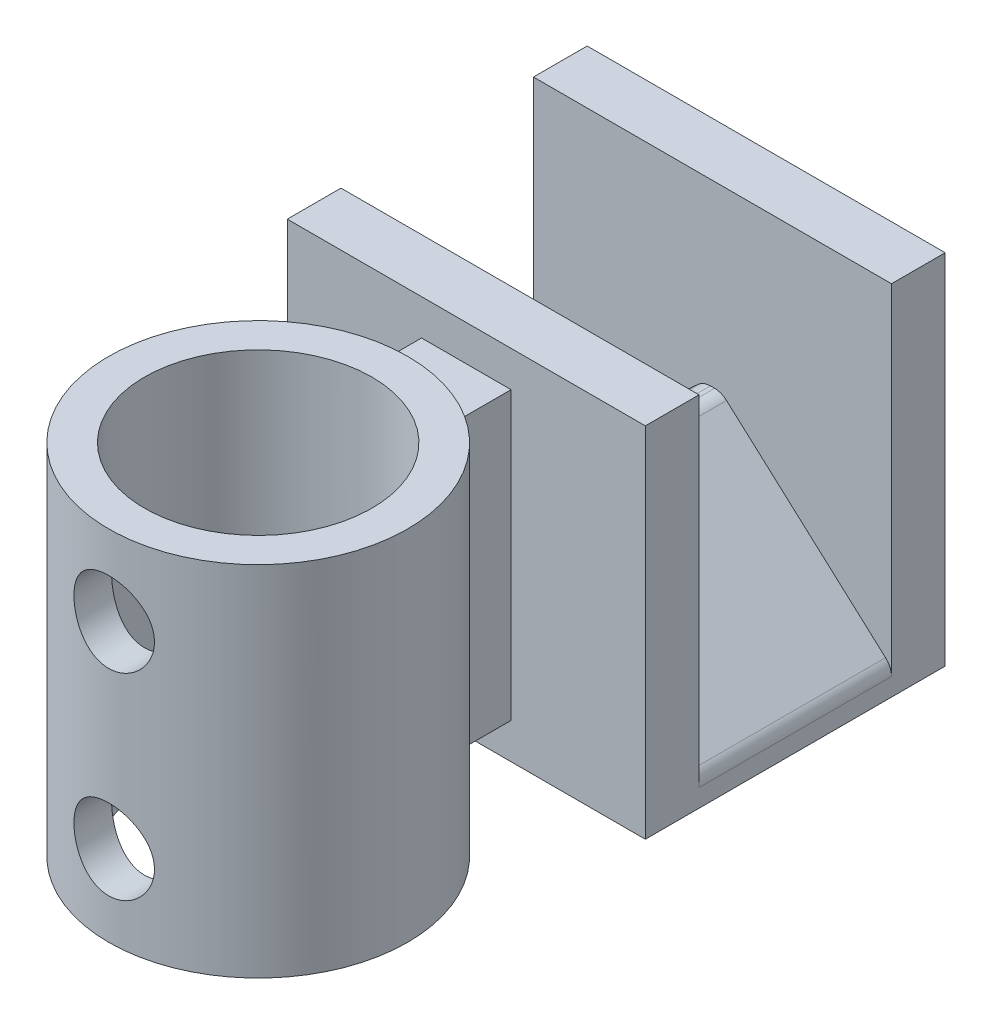
from build123d import *

# Parameters (mm, degrees)
SKETCH2_W                       = 20
SKETCH2_H                       = 10
BOSS_EXTRUDE1_DEPTH             = 5.375
CHAMFER1_SIZE                   = 9.5
CHAMFER1_SIZE2                  = 8.553838421
FILLET3_R                       = 1
SKETCH3_W                       = 20
SKETCH3_H                       = 20
BOSS_EXTRUDE2_DEPTH             = 3
BOSS_EXTRUDE3_REACH             = 21.878
SKETCH6_R                       = 8.35
SKETCH6_R_2                     = 6.35
BOSS_EXTRUDE3_DIRECTION_2_REACH = 21.878
BOSS_EXTRUDE4_REACH             = 28.907
BOSS_EXTRUDE4_END_RADIUS        = 8.35
SKETCH5_W                       = 5
SKETCH5_H                       = 16
CUT_EXTRUDE1_REACH              = 35.618
CUT_EXTRUDE1_END_RADIUS         = 8.35
SKETCH7_R                       = 2.25


with BuildPart() as part:
    # Sketch2 → Boss-Extrude1 (new, symmetric)
    with BuildSketch(Plane.XY):
        Rectangle(SKETCH2_W, SKETCH2_H)
    extrude(amount=BOSS_EXTRUDE1_DEPTH, both=True)

    # Chamfer1
    chamfer1_edges = [part.edges().sort_by_distance(p)[0] for p in [
        (10, 5, 0),
        (-10, 5, 0),
    ]]
    chamfer1_side = [part.faces().sort_by_distance(p)[0] for p in [
        (0, 5, 0),
    ]]
    chamfer(chamfer1_edges, length=CHAMFER1_SIZE, length2=CHAMFER1_SIZE2, reference=chamfer1_side[0])

    # Fillet3
    fillet3_edges = [part.edges().sort_by_distance(p)[0] for p in [
        (-10, -3.553838421, 0),
        (10, -3.553838421, 0),
        (0.5, 5, 0),
        (-0.5, 5, 0),
    ]]
    fillet(fillet3_edges, radius=FILLET3_R)

    # Sketch3 → Boss-Extrude2 (add)
    with BuildSketch(Plane.XY.offset(5.375)):
        with Locations((0, 5)):
            Rectangle(SKETCH3_W, SKETCH3_H)
    boss_extrude2 = extrude(amount=BOSS_EXTRUDE2_DEPTH)

    # Mirror1: Boss-Extrude2 across plane
    add(boss_extrude2.mirror(Plane.XY))


with BuildPart() as body_2:

    # Boss-Extrude3: up to this face of the body (flat: up to its plane)
    boss_extrude3_end = Plane(part.part.faces().sort_by_distance((0, 15, 6.875))[0])
    # Sketch6 → Boss-Extrude3 (new, up to the picked face)
    with BuildSketch(Plane(origin=(0, 0, 0), x_dir=(1, 0, 0), z_dir=(0, 1, 0)), mode=Mode.PRIVATE) as boss_extrude3_sk1:
        with Locations((0, -20)):
            Circle(SKETCH6_R)
        with Locations((0, -20)):
            Circle(SKETCH6_R_2, mode=Mode.SUBTRACT)
    boss_extrude3_tool1 = split(extrude(boss_extrude3_sk1.sketch, amount=BOSS_EXTRUDE3_REACH, mode=Mode.PRIVATE), bisect_by=boss_extrude3_end, keep=Keep.BOTH, mode=Mode.PRIVATE)
    add(boss_extrude3_tool1.solids().sort_by(Axis((-8.113826, 0, 20), (0, 1, 0)))[0])


    # Boss-Extrude3 direction 2: up to this face of the body (flat: up to its plane)
    boss_extrude3_direction_2_end = Plane(part.part.faces().sort_by_distance((0, -5, 0))[0])
    # Sketch6 → Boss-Extrude3 direction 2 (add, up to the picked face)
    with BuildSketch(Plane(origin=(0, 0, 0), x_dir=(1, 0, 0), z_dir=(0, 1, 0)), mode=Mode.PRIVATE) as boss_extrude3_direction_2_sk1:
        with Locations((0, -20)):
            Circle(SKETCH6_R)
        with Locations((0, -20)):
            Circle(SKETCH6_R_2, mode=Mode.SUBTRACT)
    boss_extrude3_direction_2_tool1 = split(extrude(boss_extrude3_direction_2_sk1.sketch, amount=-BOSS_EXTRUDE3_DIRECTION_2_REACH, mode=Mode.PRIVATE), bisect_by=boss_extrude3_direction_2_end, keep=Keep.BOTH, mode=Mode.PRIVATE)
    add(boss_extrude3_direction_2_tool1.solids().sort_by(Axis((-8.113826, 0, 20), (0, -1, 0)))[0])


with BuildPart() as part_1:
    add(part.part)

    add(body_2.part)  # Boss-Extrude4 merges body 2
    # Boss-Extrude4: up to this cylinder (the profile starts outside it)
    boss_extrude4_end = Plane(origin=(0, 5, 20), z_dir=(0, -1, 0)) * Cylinder(BOSS_EXTRUDE4_END_RADIUS, 75.514, mode=Mode.PRIVATE)
    # Sketch5 → Boss-Extrude4 (add, up to the surface)
    with BuildSketch(Plane.XY.offset(8.375), mode=Mode.PRIVATE) as boss_extrude4_sk1:
        with Locations((0, 5)):
            Rectangle(SKETCH5_W, SKETCH5_H)
    boss_extrude4_tool1 = extrude(boss_extrude4_sk1.sketch, amount=BOSS_EXTRUDE4_REACH, mode=Mode.PRIVATE) - boss_extrude4_end
    add(boss_extrude4_tool1.solids().sort_by_distance((0, 5, 8.375))[0])

    # Cut-Extrude1: up to this cylinder (the profile starts inside it)
    cut_extrude1_end = Plane(origin=(0, 5, 20), z_dir=(0, -1, 0)) * Cylinder(CUT_EXTRUDE1_END_RADIUS, 99.936, mode=Mode.PRIVATE)
    # Sketch7 → Cut-Extrude1 (cut, up to the surface)
    with BuildSketch(Plane.XY.offset(20), mode=Mode.PRIVATE) as cut_extrude1_sk1:
        with Locations((0, 10.5)):
            Circle(SKETCH7_R)
    cut_extrude1_tool1 = extrude(cut_extrude1_sk1.sketch, amount=CUT_EXTRUDE1_REACH, mode=Mode.PRIVATE) & cut_extrude1_end
    add(cut_extrude1_tool1.solids().sort_by_distance((0, 10.5, 20))[0], mode=Mode.SUBTRACT)
    # Sketch7 → Cut-Extrude1 (cut, up to the surface)
    with BuildSketch(Plane.XY.offset(20), mode=Mode.PRIVATE) as cut_extrude1_sk2:
        with Locations((0, -0.5)):
            Circle(SKETCH7_R)
    cut_extrude1_tool2 = extrude(cut_extrude1_sk2.sketch, amount=CUT_EXTRUDE1_REACH, mode=Mode.PRIVATE) & cut_extrude1_end
    add(cut_extrude1_tool2.solids().sort_by_distance((0, -0.5, 20))[0], mode=Mode.SUBTRACT)


solid = part_1.part
